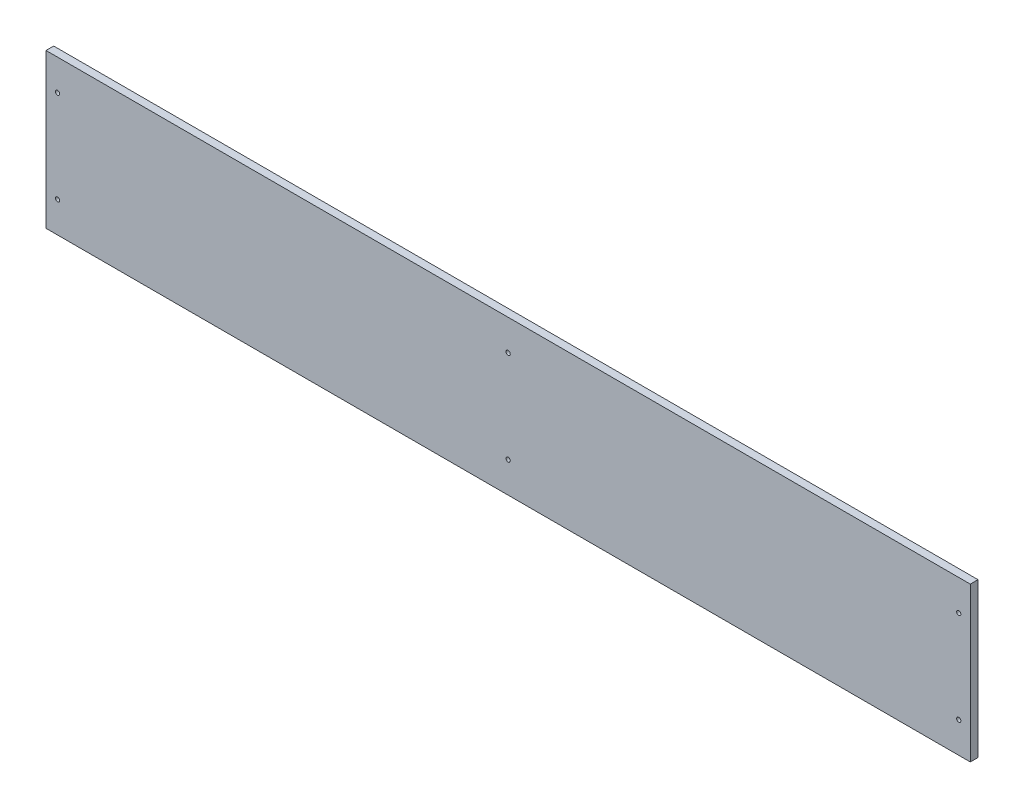
from build123d import *

# Parameters (mm, degrees)
ESQUISSE1_W             = 1200
ESQUISSE1_H             = 200
BOSS_EXTRU_1_DEPTH      = 10
ESQUISSE2_R             = 2.75
ENL_V_MAT_EXTRU_1_DEPTH = 10
CHANFREIN1_SIZE         = 2.5


with BuildPart() as part:
    # Esquisse1 → Boss.-Extru.1 (new body)
    with BuildSketch(Plane.XY):
        with Locations((600, -100)):
            Rectangle(ESQUISSE1_W, ESQUISSE1_H)
    extrude(amount=BOSS_EXTRU_1_DEPTH)

    # Esquisse2 → Enlèv. mat.-Extru.1 (cut)
    with BuildSketch(Plane.XY.offset(10)):
        with Locations((15, -40)):
            Circle(ESQUISSE2_R)
        with Locations((15, -160)):
            Circle(ESQUISSE2_R)
        with Locations((1185, -40)):
            Circle(ESQUISSE2_R)
        with Locations((1185, -160)):
            Circle(ESQUISSE2_R)
        with Locations((600, -40)):
            Circle(ESQUISSE2_R)
        with Locations((600, -160)):
            Circle(ESQUISSE2_R)
    extrude(amount=-ENL_V_MAT_EXTRU_1_DEPTH, mode=Mode.SUBTRACT)

    # Chanfrein1
    chanfrein1_edges = [part.edges().sort_by_distance(p)[0] for p in [
        (12.25, -160, 0),
        (12.25, -40, 0),
        (1182.25, -40, 0),
        (1182.25, -160, 0),
        (597.25, -160, 0),
        (597.25, -40, 0),
    ]]
    chamfer(chanfrein1_edges, length=CHANFREIN1_SIZE)


solid = part.part
